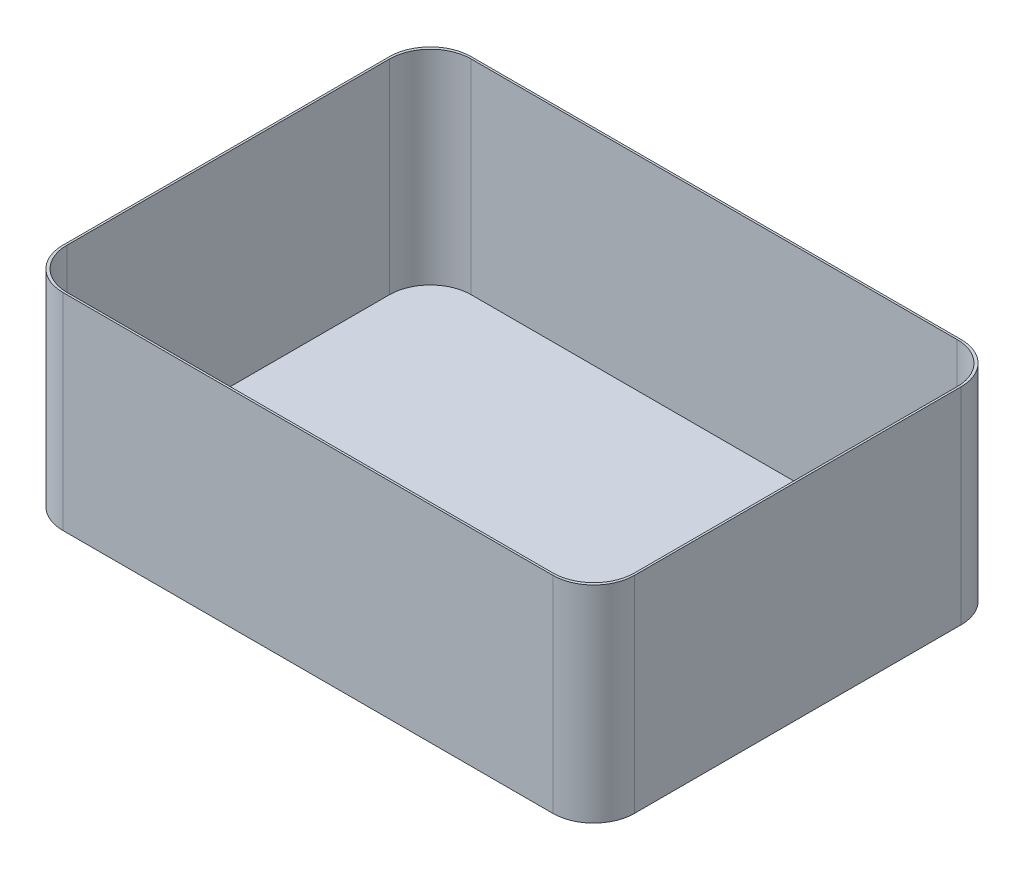
from build123d import *

# Parameters (mm, degrees)
SKETCH1_W           = 711.2
SKETCH1_H           = 508
SKETCH1_W_2         = 706.12
SKETCH1_H_2         = 502.92
BOSS_EXTRUDE1_DEPTH = 254
SKETCH2_W           = 711.2
SKETCH2_H           = 508
BOSS_EXTRUDE2_DEPTH = 2.54
FILLET1_R           = 50.8


with BuildPart() as part:
    # Sketch1 → Boss-Extrude1 (new body)
    with BuildSketch(Plane(origin=(0, 0, 0), x_dir=(1, 0, 0), z_dir=(0, 1, 0))):
        Rectangle(SKETCH1_W, SKETCH1_H)
        Rectangle(SKETCH1_W_2, SKETCH1_H_2, mode=Mode.SUBTRACT)
    extrude(amount=BOSS_EXTRUDE1_DEPTH)

    # Sketch2 → Boss-Extrude2 (add)
    with BuildSketch(Plane.XZ):
        Rectangle(SKETCH2_W, SKETCH2_H)
    extrude(amount=BOSS_EXTRUDE2_DEPTH)

    # Fillet1
    fillet1_edges = [part.edges().sort_by_distance(p)[0] for p in [
        (353.06, 127, 251.46),
        (-353.06, 127, 251.46),
        (-353.06, 127, -251.46),
        (353.06, 127, -251.46),
        (355.6, 125.73, -254),
        (355.6, 125.73, 254),
        (-355.6, 125.73, 254),
        (-355.6, 125.73, -254),
    ]]
    fillet(fillet1_edges, radius=FILLET1_R)


solid = part.part
